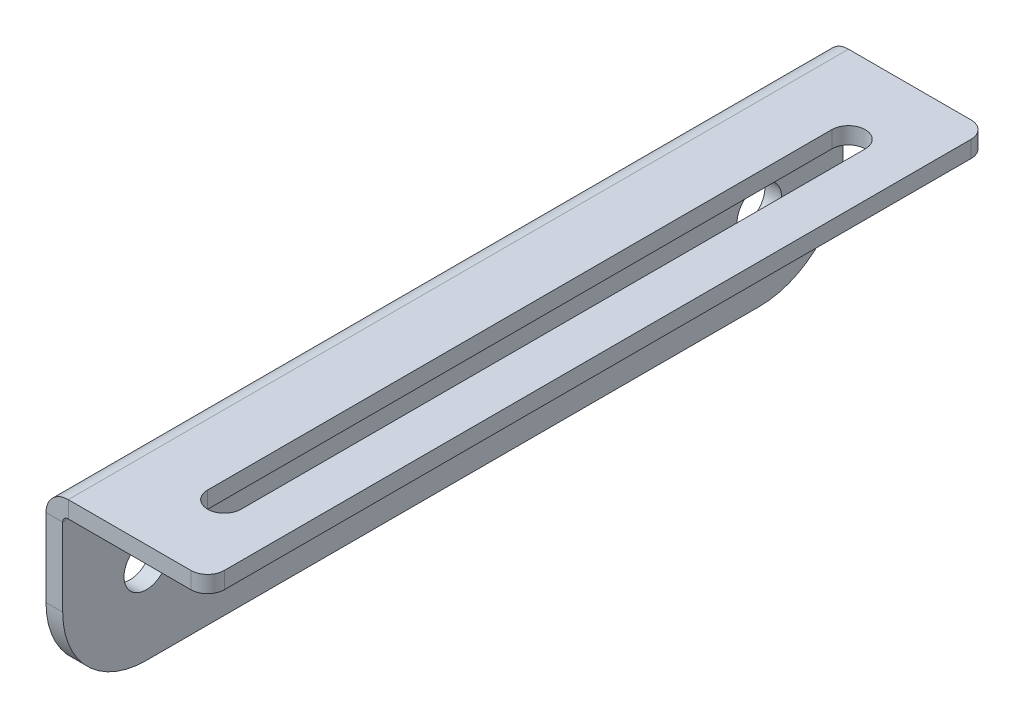
from build123d import *

# Parameters (mm, degrees)
BASE_FLANGE1_DEPTH           = 3
EDGE_FLANGE1_STRIP_W         = 14
EDGE_FLANGE1_STRIP_H         = 3
EDGE_FLANGE1_STRIP_CUT_DEPTH = 140
EDGE_FLANGE1_DEPTH           = 140
CUT_EXTRUDE1_REACH           = 84.644
SKETCH10_R                   = 4


# Sheet-metal steps are written as plain solids
with BuildPart() as part:
    # Sketch1 → Base-Flange1 (new body)
    with BuildSketch(Plane(origin=(0, 0, 0), x_dir=(1, 0, 0), z_dir=(0, 1, 0))):
        with BuildLine():
            Line((-14.5, 70), (11.5, 70))
            ThreePointArc((11.5, 70), (13.621320344, 69.121320344), (14.5, 67))
            Line((14.5, 67), (14.5, -67))
            ThreePointArc((14.5, -67), (13.621320344, -69.121320344), (11.5, -70))
            Line((11.5, -70), (-14.5, -70))
            Line((-14.5, -70), (-14.5, 70))
        make_face()
        with BuildLine():
            Line((6.5, 56), (6.5, -56))
            ThreePointArc((6.5, -56), (3.5, -59), (0.5, -56))
            Line((0.5, -56), (0.5, 56))
            ThreePointArc((0.5, 56), (3.5, 59), (6.5, 56))
        make_face(mode=Mode.SUBTRACT)
    extrude(amount=-BASE_FLANGE1_DEPTH)

    # Edge-Flange1 strip (across the edge) → Edge-Flange1 strip cut (cut)
    with BuildSketch(Plane(origin=(-14.5, -3, 70), x_dir=(1, 0, 0), z_dir=(0, 0, -1))):
        with Locations((-3, -1.5)):
            Rectangle(EDGE_FLANGE1_STRIP_W, EDGE_FLANGE1_STRIP_H)
    extrude(amount=EDGE_FLANGE1_STRIP_CUT_DEPTH, mode=Mode.SUBTRACT)

    # Edge-Flange1 section (across the edge) → Edge-Flange1 (add)
    with BuildSketch(Plane(origin=(-14.5, -3, 70), x_dir=(1, 0, 0), z_dir=(0, 0, -1))):
        with BuildLine():
            Line((0, 1), (0, 30))
            Line((0, 30), (3, 30))
            Line((3, 30), (3, 1))
            ThreePointArc((3, 1), (3.292893219, 0.292893219), (4, 0))
            Line((4, 0), (4, -3))
            ThreePointArc((4, -3), (1.171572875, -1.828427125), (0, 1))
        make_face()
    extrude(amount=EDGE_FLANGE1_DEPTH)

    # Sketch10 → Cut-Extrude1 (cut, up to next)
    with BuildSketch(Plane.ZY.offset(14.5), mode=Mode.PRIVATE) as cut_extrude1_sk1:
        with BuildLine():
            ThreePointArc((-55, -33), (-65.606601718, -28.606601718), (-70, -18))
            Line((-70, -18), (-70, -33))
            Line((-70, -33), (-55, -33))
        make_face()
    cut_extrude1_tool1 = extrude(cut_extrude1_sk1.sketch, amount=-CUT_EXTRUDE1_REACH, mode=Mode.PRIVATE) & part.part
    # Sketch10 → Cut-Extrude1 (cut, up to next)
    with BuildSketch(Plane.ZY.offset(14.5), mode=Mode.PRIVATE) as cut_extrude1_sk2:
        with BuildLine():
            Line((55, -33), (70, -33))
            Line((70, -33), (70, -18))
            ThreePointArc((70, -18), (65.606601718, -28.606601718), (55, -33))
        make_face()
    cut_extrude1_tool2 = extrude(cut_extrude1_sk2.sketch, amount=-CUT_EXTRUDE1_REACH, mode=Mode.PRIVATE) & part.part
    # Sketch10 → Cut-Extrude1 (cut, up to next)
    with BuildSketch(Plane.ZY.offset(14.5), mode=Mode.PRIVATE) as cut_extrude1_sk3:
        with Locations(Location((-55, -18, 0), (0, 0, 270))):
            Circle(SKETCH10_R)
    cut_extrude1_tool3 = extrude(cut_extrude1_sk3.sketch, amount=-CUT_EXTRUDE1_REACH, mode=Mode.PRIVATE) & part.part
    # Sketch10 → Cut-Extrude1 (cut, up to next)
    with BuildSketch(Plane.ZY.offset(14.5), mode=Mode.PRIVATE) as cut_extrude1_sk4:
        with Locations(Location((55, -18, 0), (0, 0, 270))):
            Circle(SKETCH10_R)
    cut_extrude1_tool4 = extrude(cut_extrude1_sk4.sketch, amount=-CUT_EXTRUDE1_REACH, mode=Mode.PRIVATE) & part.part
    add(cut_extrude1_tool1.solids().sort_by_distance((-14.5, -29.649481, -66.649481))[0], mode=Mode.SUBTRACT)
    add(cut_extrude1_tool2.solids().sort_by_distance((-14.5, -29.649481, 66.649481))[0], mode=Mode.SUBTRACT)
    add(cut_extrude1_tool3.solids().sort_by_distance((-14.5, -18, -55))[0], mode=Mode.SUBTRACT)
    add(cut_extrude1_tool4.solids().sort_by_distance((-14.5, -18, 55))[0], mode=Mode.SUBTRACT)


solid = part.part
